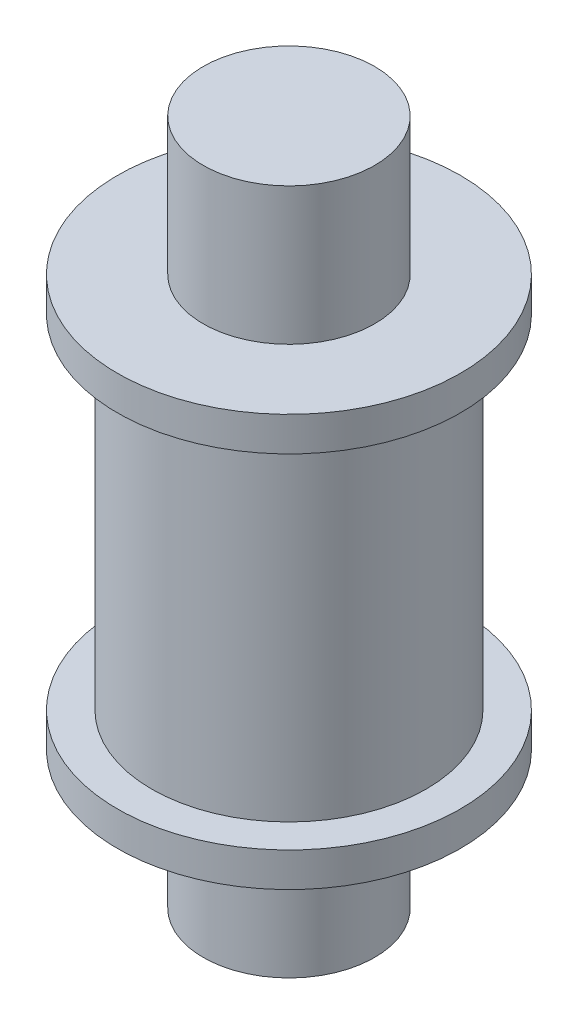
from build123d import *


with BuildPart() as part:
    # Sketch1 → Revolve1 (revolve)
    with BuildSketch(Plane.XY):
        Polygon((0, -20), (5, -20), (5, -12), (10, -12), (10, -10), (8, -10), (8, 10), (10, 10), (10, 12), (5, 12), (5, 20), (0, 20), align=None)
    revolve(axis=Axis((0, -20, 0), (0, 1, 0)))


solid = part.part
